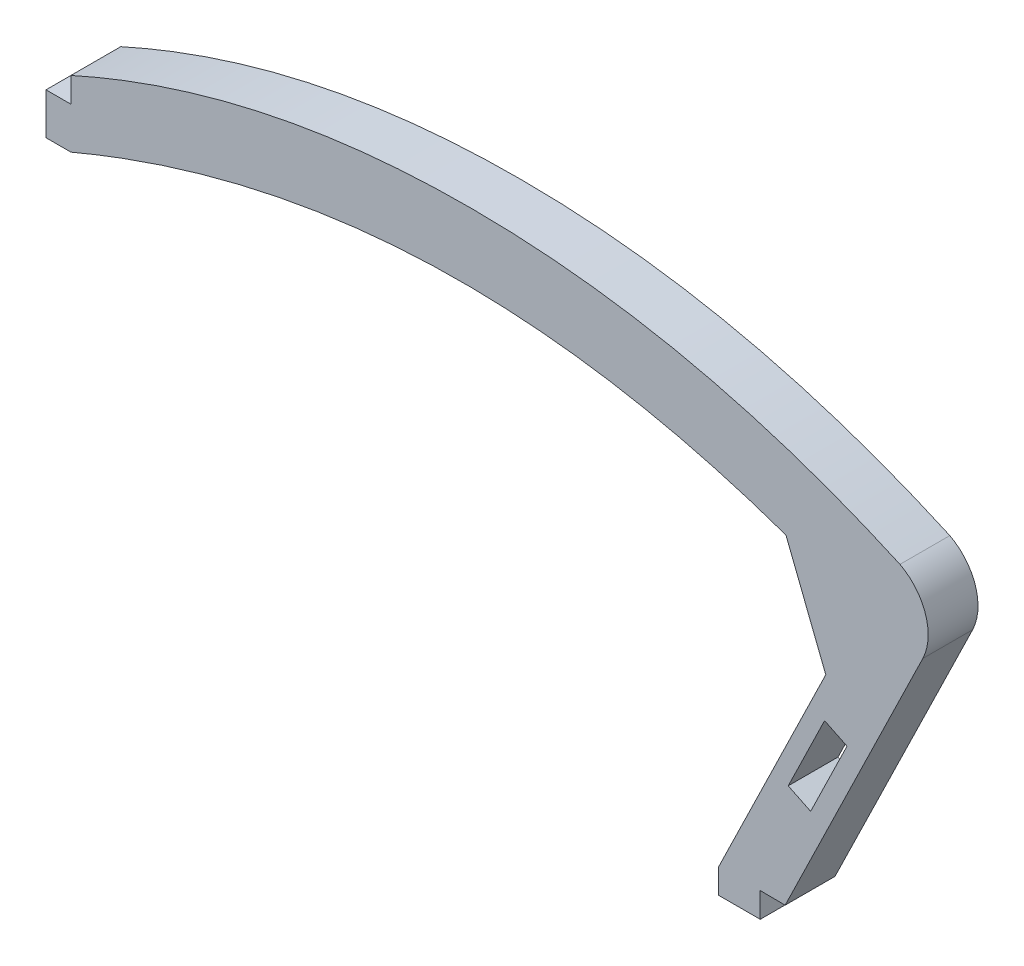
from build123d import *

# Parameters (mm, degrees)
BOSS_EXTRUDE1_DEPTH = 6
CHAMFER1_DEPTH      = 6
CUT_EXTRUDE1_DEPTH  = 6


with BuildPart() as part:
    # Sketch1 → Boss-Extrude1 (new body)
    with BuildSketch(Plane.XY):
        with BuildLine():
            Line((5, -3), (5, 0))
            Line((5, 0), (7.999917137, -0.022297349))
            Line((7.999917137, -0.022297349), (24.574810766, 33.988914515))
            ThreePointArc((24.574810766, 33.988914515), (24.906699983, 38.765486885), (21.826463092, 42.431265759))
            add(Edge.make_bspline(
                [(21.826463092, 42.431265759), (4.303477857, 50.343378655), (-29.026405502, 57.018304793), (-62.241820335, 50.620507444), (-77.999999998, 43.5)],
                knots=[0.018384898, 0.018384898, 0.018384898, 0.018384898, 0.528855814, 0.991084545, 0.991084545, 0.991084545, 0.991084545], degree=3))
            Line((-77.999999998, 43.5), (-77.999999998, 40.5))
            Line((-77.999999998, 40.5), (-81, 40.5))
            Line((-81, 40.5), (-81, 35.5))
            Line((-81, 35.5), (-78, 35.5))
            add(Edge.make_bspline(
                [(17.092660216, 35.073654222), (-30.383266578, 55.711591107), (-78, 35.5)],
                knots=[0, 0, 0, 1, 1, 1], degree=2))
            Line((17.092660216, 35.073654222), (0, 0))
            Line((0, 0), (0, -3))
            Line((0, -3), (5, -3))
        make_face()
    extrude(amount=BOSS_EXTRUDE1_DEPTH)

    # Chamfer1: read off the stored shape, not the designer's step
    # Chamfer1 outline → Chamfer1 (add)
    with BuildSketch(Plane.XY):
        with BuildLine():
            Line((8.096256687, 38.617267247), (12.890218446, 26.45036284))
            Line((12.890218446, 26.45036284), (17.092660216, 35.073654222))
            add(Edge.make_bspline(
                [(17.092660216, 35.073654222), (12.595090284, 37.028762224), (8.096256687, 38.617267247)],
                knots=[0, 0, 0, 0.094733694, 0.094733694, 0.094733694], degree=2))
        make_face()
    extrude(amount=CHAMFER1_DEPTH)

    # Sketch4 → Cut-Extrude1 (cut)
    with BuildSketch(Plane.XY.offset(6)):
        Polygon((8.369117538, 12.607849604), (12.74995002, 21.597193671), (15.44675324, 20.282943927), (11.065920758, 11.293599859), align=None)
    extrude(amount=-CUT_EXTRUDE1_DEPTH, mode=Mode.SUBTRACT)


solid = part.part
